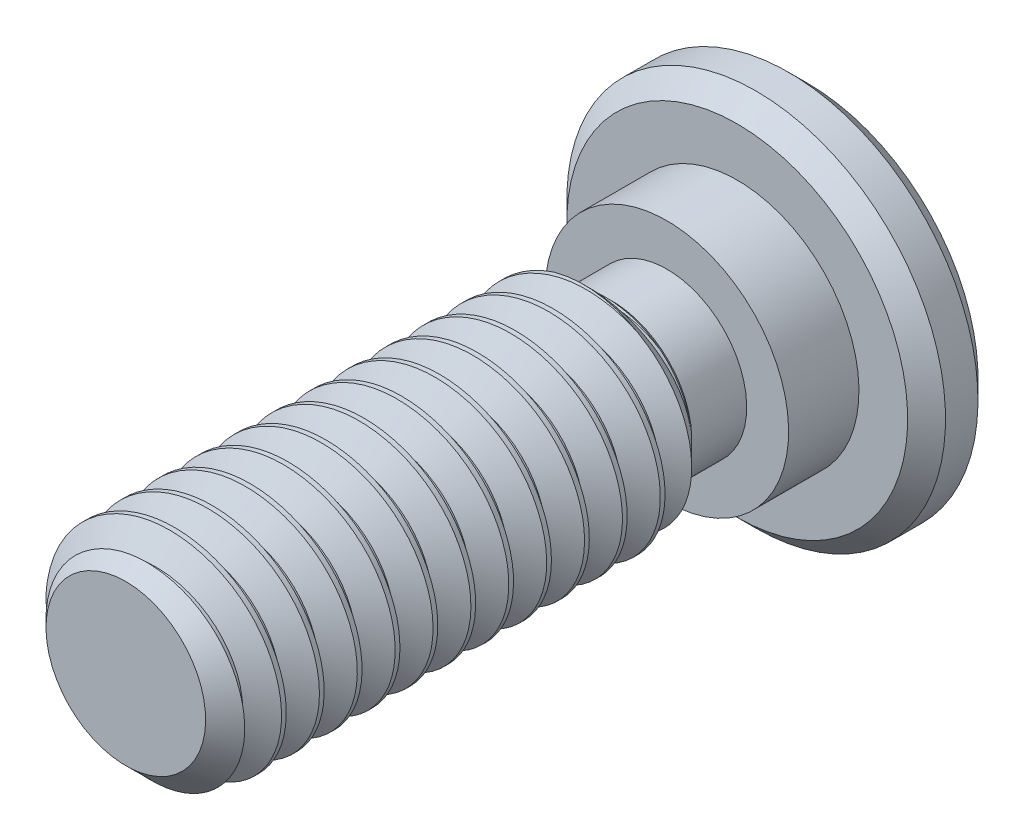
from build123d import *

# Parameters (mm, degrees)
CHAMFER2_SIZE      = 0.525
CUT_EXTRUDE1_DEPTH = 1.875
CHAMFER1_SIZE      = 0.35
CUT_SWEEP1_PITCH   = 0.7


with BuildPart() as part:
    # Sketch13 → Revolve1 (revolve)
    with BuildSketch(Plane(origin=(0, 0, 0), x_dir=(0, 0, -1), z_dir=(1, 0, 0)), mode=Mode.PRIVATE) as revolve1_sk:
        Polygon((1.3, 3.5), (0, 3.5), (0, 2.25), (-1.3, 2.25), (-1.3, 1.475), (-2.316, 1.475), (-2.841, 2), (-11.3, 2), (-11.3, 0), (1.3, 0), align=None)
    revolve(revolve1_sk.sketch.rotate(Axis((0, 0, 11.3), (0, 0, -1)), 180), axis=Axis((0, 0, 11.3), (0, 0, -1)))

    # Chamfer2
    chamfer2_edges = [part.edges().sort_by_distance(p)[0] for p in [
        (0, 2, 11.3),
    ]]
    chamfer(chamfer2_edges, length=CHAMFER2_SIZE)

    # Sketch7 → Cut-Extrude1 (cut)
    with BuildSketch(Plane(origin=(0, 0, -1.3), x_dir=(-1, 0, 0), z_dir=(0, 0, -1))):
        Polygon((0, 1.443375673), (-1.25, 0.721687836), (-1.25, -0.721687836), (0, -1.443375673), (1.25, -0.721687836), (1.25, 0.721687836), align=None)
    extrude(amount=-CUT_EXTRUDE1_DEPTH, mode=Mode.SUBTRACT)

    # Chamfer1
    chamfer1_edges = [part.edges().sort_by_distance(p)[0] for p in [
        (0, 3.5, 0),
        (0, 3.5, -1.3),
    ]]
    chamfer(chamfer1_edges, length=CHAMFER1_SIZE)

    # Cut-Extrude2 cone 1 section (through the dimple's axis) → Cut-Extrude2 (revolve, cut)
    with BuildSketch(Plane(origin=(0, 0, -1.3), x_dir=(0, 1, 0), z_dir=(1, 0, 0))):
        Polygon((0, 0), (1.443375673, 0), (0, 1.443375673), align=None)
    revolve(axis=Axis((0, 0, -1.3), (0, 0, 1)), mode=Mode.SUBTRACT)

    # Cut-Sweep1: the profile of Sketch3 screwed along a right-hand helix of 14.142857 turns, 6 arcs to a turn; built about Z, then put on its axis
    cut_sweep1_z = Axis((0, 0, 0), (0, 0, 1))
    cut_sweep1_corners = [(2.037888611, 0, -0.634375), (2.037888611, 0, 0.021875), (1.545336663, 0, -0.2625), (1.545336663, 0, -0.35)]
    with BuildLine(mode=Mode.PRIVATE) as cut_sweep1_profile:
        Line(cut_sweep1_corners[0], cut_sweep1_corners[1])
        Line(cut_sweep1_corners[1], cut_sweep1_corners[2])
        Line(cut_sweep1_corners[2], cut_sweep1_corners[3])
        Line(cut_sweep1_corners[3], cut_sweep1_corners[0])
    cut_sweep1_cap = Face(cut_sweep1_profile.wire())
    cut_sweep1_turn_angles = [0, 30, 60, 90, 120, 150, 180, 210, 240, 270, 300, 330, 360]
    cut_sweep1_turn_weights = [1, 0.8660254037844387, 1, 0.8660254037844387, 1, 0.8660254037844387, 1, 0.8660254037844387, 1, 0.8660254037844387, 1, 0.8660254037844387, 1]
    cut_sweep1_turn_rails = [Edge.make_bspline([Vector(p[0], p[1], 0).rotate(cut_sweep1_z, cut_sweep1_turn_angles[k]) / cut_sweep1_turn_weights[k] + Vector(0, 0, p[2] + CUT_SWEEP1_PITCH * cut_sweep1_turn_angles[k] / 360) for k in range(13)], [0, 0, 0, 1, 1, 2, 2, 3, 3, 4, 4, 5, 5, 6, 6, 6], 2, cut_sweep1_turn_weights) for p in cut_sweep1_corners]
    cut_sweep1_turn_sides = [Face.make_surface_from_curves(cut_sweep1_turn_rails[p[0]], cut_sweep1_turn_rails[p[1]]) for p in [(0, 1), (1, 2), (2, 3), (3, 0)]]
    cut_sweep1_last_angles = [5040, 5065.714285714, 5091.428571429]
    cut_sweep1_last_weights = [1, 0.9009688679024083, 1]
    cut_sweep1_last_rails = [Edge.make_bspline([Vector(p[0], p[1], 0).rotate(cut_sweep1_z, cut_sweep1_last_angles[k]) / cut_sweep1_last_weights[k] + Vector(0, 0, p[2] + CUT_SWEEP1_PITCH * cut_sweep1_last_angles[k] / 360) for k in range(3)], [0, 0, 0, 1, 1, 1], 2, cut_sweep1_last_weights) for p in cut_sweep1_corners]
    cut_sweep1_last_sides = [Face.make_surface_from_curves(cut_sweep1_last_rails[p[0]], cut_sweep1_last_rails[p[1]]) for p in [(0, 1), (1, 2), (2, 3), (3, 0)]]
    cut_sweep1 = Plane(origin=(0, 0, 11.3), x_dir=(0, 1, 0), z_dir=(0, 0, -1)) * Solid(Shell([*[p.moved(Location((0, 0, CUT_SWEEP1_PITCH * i))) for i in range(14) for p in cut_sweep1_turn_sides], *cut_sweep1_last_sides, cut_sweep1_cap, cut_sweep1_cap.rotate(cut_sweep1_z, 5091.428571429).moved(Location((0, 0, CUT_SWEEP1_PITCH * 5091.428571429 / 360)))]))
    add(cut_sweep1, mode=Mode.SUBTRACT)


solid = part.part
